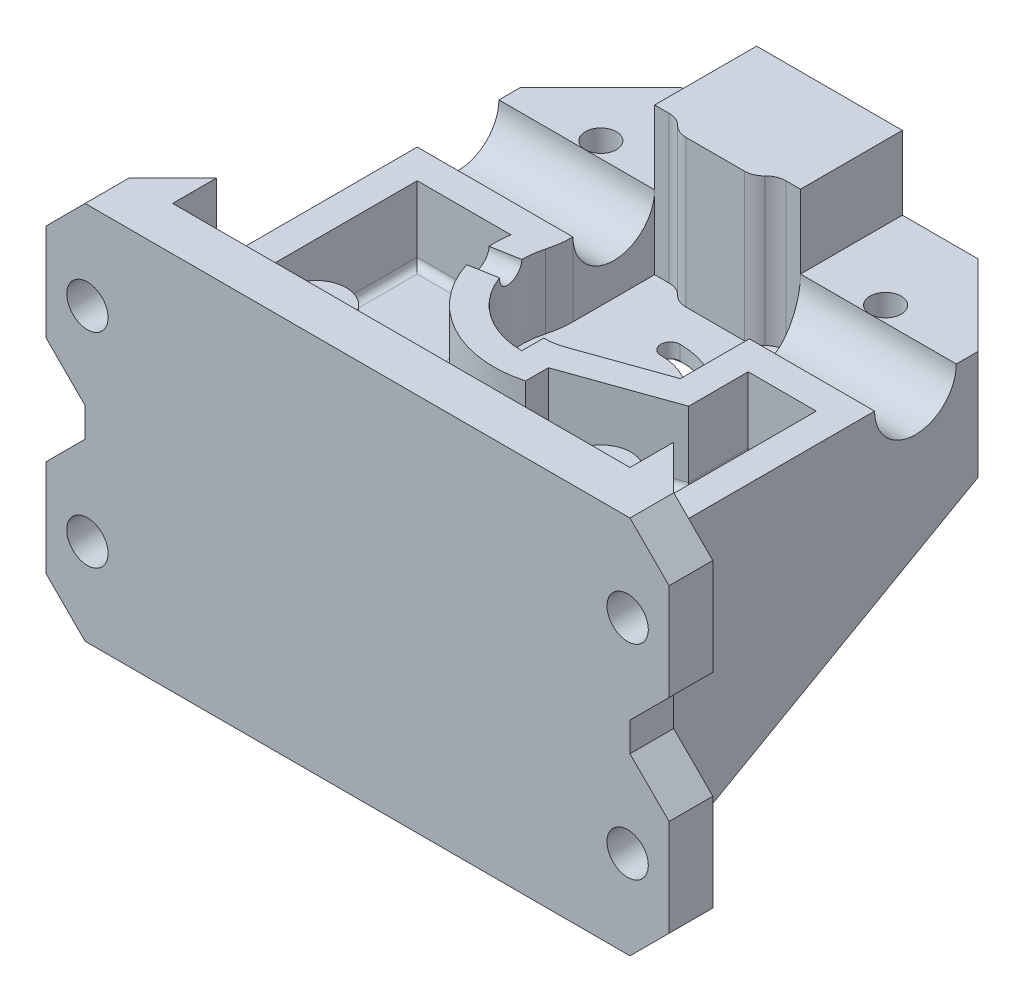
from build123d import *

# Parameters (mm, degrees)
BOSS_EXTRUDE1_DEPTH             = 33.909
CUT_EXTRUDE1_DEPTH              = 70.971972376
BOSS_EXTRUDE2_REACH             = 67.168
BOSS_EXTRUDE2_DIRECTION_2_REACH = 67.168
SKETCH3_R                       = 2.25
CUT_EXTRUDE2_DEPTH              = 62.483683724
SKETCH5_R                       = 4.125
CUT_EXTRUDE3_DEPTH              = 62.483683724
BOSS_EXTRUDE3_DEPTH             = 3.175
CHAMFER1_SIZE                   = 3.175
CUT_EXTRUDE4_DEPTH              = 81.960563335
CUT_EXTRUDE5_DEPTH              = 66.16805579
CUT_EXTRUDE5_DEPTH_BACK         = 66.16805579
SKETCH8_R                       = 2.54
SKETCH8_R_2                     = 1.7
SKETCH8_3_R                     = 11.0998
SKETCH8_3_R_2                   = 2.54
CUT_EXTRUDE6_DEPTH              = 2.286
CUT_EXTRUDE7_DEPTH              = 81.960563335
CUT_EXTRUDE7_DEPTH_BACK         = 81.960563335
SKETCH9_R                       = 4.445
SKETCH10_W                      = 15.875
SKETCH10_H                      = 11.092
BOSS_EXTRUDE4_DEPTH             = 8
CUT_EXTRUDE8_DEPTH              = 8
SKETCH12_W                      = 12.7
SKETCH12_H                      = 7.917
CUT_EXTRUDE9_DEPTH              = 18.286
CUT_EXTRUDE10_DEPTH             = 8
FILLET1_R                       = 0.79375
CUT_EXTRUDE11_REACH             = 71.954
CUT_EXTRUDE11_END_RADIUS        = 8.60425
SKETCH15_R                      = 1.5
CUT_EXTRUDE12_REACH             = 68.541
BOSS_EXTRUDE6_REACH             = 76.111


# Read off the part's stored shape, not the designer's step: Mirror1
with BuildPart() as part:
    # Sketch1 → Boss-Extrude1 (new, symmetric)
    with BuildSketch(Plane(origin=(0, 0, 0), x_dir=(0, 0, -1), z_dir=(1, 0, 0))):
        Polygon((0, -21.4015), (0, 19.8735), (4.7625, 19.8735), (4.7625, 11.8735), (51.3715, 11.8735), (51.3715, 0), (4.7625, 0), (4.7625, -21.4015), align=None)
    extrude(amount=BOSS_EXTRUDE1_DEPTH, both=True)

    # Sketch2 → Cut-Extrude1 (cut, symmetric)
    with BuildSketch(Plane(origin=(0, 11.8735, 0), x_dir=(1, 0, 0), z_dir=(0, 1, 0))):
        Polygon((33.909, 4.7625), (29.6545, 4.7625), (24.892, 9.525), (24.892, 42.644487102), (16.164987102, 51.3715), (23.7109, 51.3715), (33.909, 51.3715), align=None)
    extrude(amount=CUT_EXTRUDE1_DEPTH, both=True, mode=Mode.SUBTRACT)

    # Boss-Extrude2: up to this face of the body (flat: up to its plane)
    boss_extrude2_end = Plane(part.part.faces().sort_by_distance((0, -21.4015, -2.38125))[0])
    # Sketch4 → Boss-Extrude2 (add, up to the picked face)
    with BuildSketch(Plane.XZ, mode=Mode.PRIVATE) as boss_extrude2_sk1:
        Polygon((24.892, -9.525), (29.6545, -4.7625), (24.892, -4.7625), align=None)
    boss_extrude2_tool1 = split(extrude(boss_extrude2_sk1.sketch, amount=BOSS_EXTRUDE2_REACH, mode=Mode.PRIVATE), bisect_by=boss_extrude2_end, keep=Keep.BOTH, mode=Mode.PRIVATE)
    add(boss_extrude2_tool1.solids().sort_by(Axis((26.4795, 0, -6.35), (0, -1, 0)))[0])

    # Boss-Extrude2 direction 2: up to this face of the body (flat: up to its plane)
    boss_extrude2_direction_2_end = Plane(part.part.faces().sort_by_distance((0, 19.8735, -2.38125))[0])
    # Sketch4 → Boss-Extrude2 direction 2 (add, up to the picked face)
    with BuildSketch(Plane.XZ, mode=Mode.PRIVATE) as boss_extrude2_direction_2_sk1:
        Polygon((24.892, -9.525), (29.6545, -4.7625), (24.892, -4.7625), align=None)
    boss_extrude2_direction_2_tool1 = split(extrude(boss_extrude2_direction_2_sk1.sketch, amount=-BOSS_EXTRUDE2_DIRECTION_2_REACH, mode=Mode.PRIVATE), bisect_by=boss_extrude2_direction_2_end, keep=Keep.BOTH, mode=Mode.PRIVATE)
    add(boss_extrude2_direction_2_tool1.solids().sort_by(Axis((26.4795, 0, -6.35), (0, 1, 0)))[0])

    # Sketch3 → Cut-Extrude2 (cut, symmetric)
    with BuildSketch(Plane(origin=(0, 0, -4.7625), x_dir=(-1, 0, 0), z_dir=(0, 0, -1))):
        with Locations(Location((-29.4005, 10.3485, 0), (0, 0, 90))):
            Circle(SKETCH3_R)
        with Locations(Location((-29.4005, -11.8765, 0), (0, 0, 90))):
            Circle(SKETCH3_R)
        Polygon((-29.6545, 19.8735), (-33.909, 15.619), (-33.909, 19.8735), align=None)
        Polygon((-33.909, 5.078), (-29.6545, 0.8235), (-29.6545, -2.3515), (-33.909, -6.606), align=None)
        Polygon((-33.909, -17.147), (-29.6545, -21.4015), (-33.909, -21.4015), align=None)
    extrude(amount=CUT_EXTRUDE2_DEPTH, both=True, mode=Mode.SUBTRACT)

    # Sketch5 → Cut-Extrude3 (cut, through all)
    with BuildSketch(Plane(origin=(0, 0, -4.7625), x_dir=(-1, 0, 0), z_dir=(0, 0, -1))):
        with Locations((-29.4005, 10.3485)):
            Circle(SKETCH5_R)
        with Locations((-29.4005, -11.8765)):
            Circle(SKETCH5_R)
    extrude(amount=CUT_EXTRUDE3_DEPTH, mode=Mode.SUBTRACT)

    # Sketch6 → Boss-Extrude3 (add)
    with BuildSketch(Plane.ZY.offset(-24.892)):
        Polygon((-4.7625, -21.4015), (-4.7625, 0), (-42.644487102, 0), align=None)
    extrude(amount=BOSS_EXTRUDE3_DEPTH)

    # Chamfer1
    chamfer1_edges = [part.edges().sort_by_distance(p)[0] for p in [
        (21.717, -10.70075, -4.7625),
    ]]
    chamfer(chamfer1_edges, length=CHAMFER1_SIZE)

    # Sketch7 → Cut-Extrude4 (cut, symmetric)
    with BuildSketch(Plane(origin=(24.892, 0, 0), x_dir=(0, 0, -1), z_dir=(1, 0, 0))):
        Polygon((9.525, -18.71091665), (4.7625, -21.4015), (9.525, -21.4015), align=None)
    extrude(amount=CUT_EXTRUDE4_DEPTH, both=True, mode=Mode.SUBTRACT)

    # Mirror1
    split(bisect_by=Plane(origin=(0, 0, 0), x_dir=(0, 0, 1), z_dir=(1, 0, 0)), keep=Keep.TOP)

    # Mirror1 2: part across plane


with BuildPart() as part_1:
    add(part.part)
    add(part.part.mirror(Plane(origin=(0, 0, 0), x_dir=(0, 0, 1), z_dir=(1, 0, 0))))

    # Sketch8 → Cut-Extrude5 (cut, two sides: drawn at the far end of the back side and taken through both)
    with BuildSketch(Plane.XZ.offset(-CUT_EXTRUDE5_DEPTH_BACK)):
        with Locations(Location((0, -26.4795, 0), (0, 0, 270))):
            Circle(SKETCH8_R)
        with Locations(Location((15.5, -10.9795, 0), (0, 0, 270))):
            Circle(SKETCH8_R_2)
        with Locations(Location((15.5, -41.9795, 0), (0, 0, 270))):
            Circle(SKETCH8_R_2)
        with Locations(Location((-15.5, -41.9795, 0), (0, 0, 270))):
            Circle(SKETCH8_R_2)
        with Locations(Location((-15.5, -10.9795, 0), (0, 0, 270))):
            Circle(SKETCH8_R_2)
    extrude(amount=CUT_EXTRUDE5_DEPTH + CUT_EXTRUDE5_DEPTH_BACK, mode=Mode.SUBTRACT)

    # Sketch8<3> → Cut-Extrude6 (cut)
    with BuildSketch(Plane.XZ):
        with Locations(Location((0, -26.4795, 0), (0, 0, 270))):
            Circle(SKETCH8_3_R)
        with Locations(Location((0, -26.4795, 0), (0, 0, 270))):
            Circle(SKETCH8_3_R_2, mode=Mode.SUBTRACT)
    extrude(amount=-CUT_EXTRUDE6_DEPTH, mode=Mode.SUBTRACT)

    # Sketch9 → Cut-Extrude7 (cut, two sides: drawn at the far end of the back side and taken through both)
    with BuildSketch(Plane(origin=(24.892, 0, 0), x_dir=(0, 0, -1), z_dir=(1, 0, 0)).offset(-CUT_EXTRUDE7_DEPTH_BACK)):
        with Locations((35.8345, 11.8735)):
            Circle(SKETCH9_R)
    extrude(amount=CUT_EXTRUDE7_DEPTH + CUT_EXTRUDE7_DEPTH_BACK, mode=Mode.SUBTRACT)

    # Sketch10 → Boss-Extrude4 (add)
    with BuildSketch(Plane(origin=(0, 11.8735, 0), x_dir=(1, 0, 0), z_dir=(0, 1, 0))):
        with Locations((0, 45.8255)):
            Rectangle(SKETCH10_W, SKETCH10_H)
    extrude(amount=BOSS_EXTRUDE4_DEPTH)

    # Sketch11 → Cut-Extrude8 (cut)
    with BuildSketch(Plane(origin=(0, 11.8735, 0), x_dir=(1, 0, 0), z_dir=(0, 1, 0))):
        with BuildLine():
            Line((-7.9375, 40.2795), (7.9375, 40.2795))
            Line((7.9375, 40.2795), (11.26, 31.3895))
            Line((11.26, 31.3895), (11.26, 23.880766055))
            Line((11.26, 23.880766055), (2.086105319, 20.616574655))
            ThreePointArc((2.086105319, 20.616574655), (1.0584764, 20.347179337), (0, 20.2565))
            Line((0, 20.2565), (0, 17.87525))
            ThreePointArc((0, 17.87525), (-6.847467237, 21.26938383), (-8.292669268, 28.774005279))
            ThreePointArc((-8.292669268, 28.774005279), (-8.02669792, 30.069750228), (-7.9375, 31.3895))
            Line((-7.9375, 31.3895), (-7.9375, 40.2795))
        make_face()
    extrude(amount=-CUT_EXTRUDE8_DEPTH, mode=Mode.SUBTRACT)

    # Sketch12 → Cut-Extrude9 (cut)
    with BuildSketch(Plane.XZ):
        with Locations((0, -45.8255)):
            Rectangle(SKETCH12_W, SKETCH12_H)
    extrude(amount=-CUT_EXTRUDE9_DEPTH, mode=Mode.SUBTRACT)

    # Sketch13 → Cut-Extrude10 (cut)
    with BuildSketch(Plane(origin=(0, 11.8735, 0), x_dir=(1, 0, 0), z_dir=(0, 1, 0))):
        with BuildLine():
            Line((14.308, 21.730089687), (3.048, 17.723634801))
            Line((3.048, 17.723634801), (3.048, 15.232961596))
            ThreePointArc((3.048, 15.232961596), (-7.751371841, 17.779433066), (-11.522356749, 28.2145))
            Line((-11.522356749, 28.2145), (-21.717, 28.2145))
            Line((-21.717, 28.2145), (-21.717, 9.525))
            Line((-21.717, 9.525), (-21.717, 7.9375))
            Line((-21.717, 7.9375), (-20.152961933, 7.9375))
            ThreePointArc((-20.152961933, 7.9375), (-18.873886587, 8.584722111), (-18.637766637, 9.998644872))
            ThreePointArc((-18.637766637, 9.998644872), (-15.996109076, 14.229351079), (-12.2125, 10.9795))
            ThreePointArc((-12.2125, 10.9795), (-12.250148921, 10.483390924), (-12.362233363, 9.998644872))
            ThreePointArc((-12.362233363, 9.998644872), (-12.126113413, 8.584722111), (-10.847038067, 7.9375))
            Line((-10.847038067, 7.9375), (10.847038067, 7.9375))
            ThreePointArc((10.847038067, 7.9375), (12.126113413, 8.584722111), (12.362233363, 9.998644872))
            ThreePointArc((12.362233363, 9.998644872), (15.003890924, 14.229351079), (18.7875, 10.9795))
            ThreePointArc((18.7875, 10.9795), (18.749851079, 10.483390924), (18.637766637, 9.998644872))
            ThreePointArc((18.637766637, 9.998644872), (18.873886587, 8.584722111), (20.152961933, 7.9375))
            Line((20.152961933, 7.9375), (21.717, 7.9375))
            Line((21.717, 7.9375), (21.717, 9.525))
            Line((21.717, 9.525), (21.717, 28.2145))
            Line((21.717, 28.2145), (14.308, 28.2145))
            Line((14.308, 28.2145), (14.308, 21.730089687))
        make_face()
    extrude(amount=-CUT_EXTRUDE10_DEPTH, mode=Mode.SUBTRACT)

    # Fillet1
    fillet1_edges = [part_1.edges().sort_by_distance(p)[0] for p in [
        (3.048, 3.8735, -16.478298199),
        (8.678, 3.8735, -19.726862244),
        (14.308, 3.8735, -24.972294843),
        (12.126113413, 3.8735, -8.584722111),
        (-18.873886587, 3.8735, -8.584722111),
        (-16.619678375, 3.8735, -28.2145),
        (-7.751371841, 3.8735, -17.779433066),
        (18.0125, 3.8735, -28.2145),
        (21.717, 3.8735, -18.076),
        (20.934980967, 3.8735, -7.9375),
        (18.873886587, 3.8735, -8.584722111),
        (15.003890924, 3.8735, -14.229351079),
        (0, 3.8735, -7.9375),
        (-12.126113413, 3.8735, -8.584722111),
        (-15.996109076, 3.8735, -14.229351079),
        (-20.934980967, 3.8735, -7.9375),
        (-21.717, 3.8735, -18.076),
    ]]
    fillet(fillet1_edges, radius=FILLET1_R - 0.0001)  # a hair under: the kernel refuses the full size

    # Cut-Extrude11: up to this cylinder (the profile starts outside it)
    cut_extrude11_end = Plane(origin=(0, 11.8735, -26.4795), z_dir=(0, 1, 0)) * Cylinder(CUT_EXTRUDE11_END_RADIUS, 162.1165, mode=Mode.PRIVATE)
    # Sketch15 → Cut-Extrude11 (cut, up to the surface)
    with BuildSketch(Plane(origin=(-6.946964947, 0, 1.224937354), x_dir=(0, 1, 0), z_dir=(-0.9848077530122085, 0, 0.17364817766692803)), mode=Mode.PRIVATE) as cut_extrude11_sk1:
        with Locations((11.8735, 26.077216896)):
            Circle(SKETCH15_R)
    cut_extrude11_tool1 = extrude(cut_extrude11_sk1.sketch, amount=-CUT_EXTRUDE11_REACH, mode=Mode.PRIVATE) - cut_extrude11_end
    add(cut_extrude11_tool1.solids().sort_by_distance((-11.475226, 11.8735, -24.456108))[0], mode=Mode.SUBTRACT)

    # Sketch16 → Cut-Extrude12 (cut, up to next)
    with BuildSketch(Plane(origin=(0, 3.8735, 0), x_dir=(1, 0, 0), z_dir=(0, 1, 0)), mode=Mode.PRIVATE) as cut_extrude12_sk1:
        with BuildLine():
            ThreePointArc((8.62682, 26.4795), (6.100082922, 32.579582922), (0, 35.10632))
            ThreePointArc((0, 35.10632), (-1.05, 34.05632), (0, 33.00632))
            ThreePointArc((0, 33.00632), (4.615158682, 31.094658682), (6.52682, 26.4795))
            ThreePointArc((6.52682, 26.4795), (7.57682, 25.4295), (8.62682, 26.4795))
        make_face()
    cut_extrude12_tool1 = extrude(cut_extrude12_sk1.sketch, amount=-CUT_EXTRUDE12_REACH, mode=Mode.PRIVATE) & part_1.part
    add(cut_extrude12_tool1.solids().sort_by_distance((4.697563, 3.8735, -31.177063))[0], mode=Mode.SUBTRACT)

    # Sketch17 → Boss-Extrude6 (add, up to next)
    with BuildSketch(Plane(origin=(0, 19.8735, 0), x_dir=(1, 0, 0), z_dir=(0, 1, 0)), mode=Mode.PRIVATE) as boss_extrude6_sk1:
        with BuildLine():
            Line((-6.35, 40.2795), (6.35, 40.2795))
            ThreePointArc((6.35, 40.2795), (5.487477355, 40.103743072), (4.7625, 39.6045))
            ThreePointArc((4.7625, 39.6045), (4.037522645, 39.105256928), (3.175, 38.9295))
            Line((3.175, 38.9295), (-3.175, 38.9295))
            ThreePointArc((-3.175, 38.9295), (-4.037522645, 39.105256928), (-4.7625, 39.6045))
            ThreePointArc((-4.7625, 39.6045), (-5.487477355, 40.103743072), (-6.35, 40.2795))
        make_face()
    boss_extrude6_tool1 = extrude(boss_extrude6_sk1.sketch, amount=-BOSS_EXTRUDE6_REACH, mode=Mode.PRIVATE) - part_1.part
    add(boss_extrude6_tool1.solids().sort_by_distance((0, 19.8735, -39.653988))[0])


solid = part_1.part
